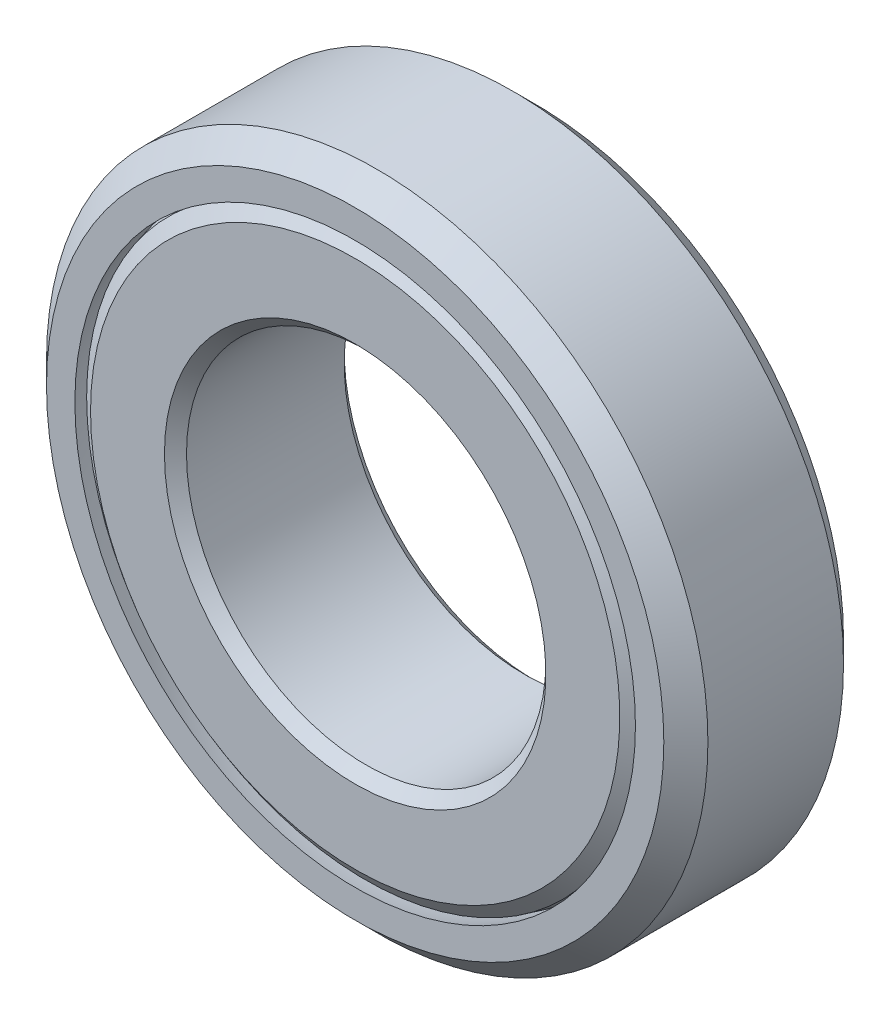
from build123d import *

# Parameters (mm, degrees)
CUT_EXTRUDE1_DEPTH      = 24.200228986
CUT_EXTRUDE1_DEPTH_BACK = 24.200228986
SKETCH7_R               = 18.62743981
SKETCH7_R_2             = 15.62743981
CUT_EXTRUDE2_DEPTH      = 23.473081119
CUT_EXTRUDE2_DEPTH_BACK = 23.473081119
SKETCH9_R               = 15.62743981
SKETCH9_R_2             = 15
CHAMFER1_SIZE           = 1
CHAMFER3_SIZE           = 0.5


with BuildPart() as part:
    # Sketch4 → Revolve4 (revolve)
    with BuildSketch(Plane(origin=(0, 0, 0), x_dir=(1, 0, 0), z_dir=(0, 1, 0))):
        with BuildLine():
            Line((-8.15, -4.075), (-8.15, 0))
            Line((-8.15, 0), (-8.15, 4.075))
            Line((-8.15, 4.075), (-12.502674714, 4.075))
            ThreePointArc((-12.502674714, 4.075), (-13.15, 0), (-12.502674714, -4.075))
            Line((-12.502674714, -4.075), (-8.15, -4.075))
        make_face()
    revolve(axis=Axis((0, 0, 13.15), (0, 0, -1)))

    # Chamfer3
    # the kernel refuses this chamfer: 0.5 mm, written as the material it takes off along each edge
    with BuildSketch(Plane(origin=(0, 0, -4.075), x_dir=(-1, 0, 0), z_dir=(0, -1, 0))) as chamfer3_piece_1:
        Polygon((8.15, -CHAMFER3_SIZE), (8.15 + CHAMFER3_SIZE, 0), (8.15, 0), align=None)
    revolve(axis=Axis((0, 0, -4.075), (0, 0, -1)), mode=Mode.SUBTRACT)
    with BuildSketch(Plane(origin=(0, 0, 4.075), x_dir=(-1, 0, 0), z_dir=(0, -1, 0))) as chamfer3_piece_2:
        Polygon((8.15 + CHAMFER3_SIZE, 0), (8.15, CHAMFER3_SIZE), (8.15, 0), align=None)
    revolve(axis=Axis((0, 0, 4.075), (0, 0, -1)), mode=Mode.SUBTRACT)
    with BuildSketch(Plane(origin=(0, 0, 4.075), x_dir=(-1, 0, 0), z_dir=(0, -1, 0))) as chamfer3_piece_3:
        with BuildLine():
            Line((12.502674714 - CHAMFER3_SIZE, 0), (12.645161709, 0.466345772))
            ThreePointArc((12.645161709, 0.466345772), (12.578409578, 0.240145049), (12.502674714, 0))
            Line((12.502674714, 0), (12.502674714 - CHAMFER3_SIZE, 0))
        make_face()
    revolve(axis=Axis((0, 0, 4.075), (0, 0, -1)), mode=Mode.SUBTRACT)
    with BuildSketch(Plane(origin=(0, 0, -4.075), x_dir=(-1, 0, 0), z_dir=(0, -1, 0))) as chamfer3_piece_4:
        with BuildLine():
            Line((12.502674714 - CHAMFER3_SIZE, 0), (12.645161709, -0.466345772))
            ThreePointArc((12.645161709, -0.466345772), (12.578409578, -0.240145049), (12.502674714, 0))
            Line((12.502674714, 0), (12.502674714 - CHAMFER3_SIZE, 0))
        make_face()
    revolve(axis=Axis((0, 0, -4.075), (0, 0, -1)), mode=Mode.SUBTRACT)


with BuildPart() as body_2:
    # Sketch6 → Revolve5 (revolve)
    with BuildSketch(Plane(origin=(0, 0, 0), x_dir=(1, 0, 0), z_dir=(0, 1, 0))):
        with BuildLine():
            ThreePointArc((-12.712862581, -4.075), (-13.35, 0), (-12.712862581, 4.075))
            Line((-12.712862581, 4.075), (-15.62743981, 4.075))
            ThreePointArc((-15.62743981, 4.075), (-16.15, 0), (-15.62743981, -4.075))
            Line((-15.62743981, -4.075), (-12.712862581, -4.075))
        make_face()
        with BuildLine():
            Line((15.62743981, 4.075), (12.712862581, 4.075))
            ThreePointArc((12.712862581, 4.075), (13.189753892, 2.062254173), (13.35, 0))
            ThreePointArc((13.35, 0), (13.189753892, -2.062254173), (12.712862581, -4.075))
            Line((12.712862581, -4.075), (15.62743981, -4.075))
            ThreePointArc((15.62743981, -4.075), (16.01882725, -2.054184397), (16.15, 0))
            ThreePointArc((16.15, 0), (16.01882725, 2.054184397), (15.62743981, 4.075))
        make_face()
    revolve(axis=Axis((0, 0, 13.15), (0, 0, -1)))

    # Sketch7 → Cut-Extrude1 (cut, two sides: drawn at the far end of the back side and taken through both)
    with BuildSketch(Plane.XY.offset(-CUT_EXTRUDE1_DEPTH_BACK)):
        Circle(SKETCH7_R)
        Circle(SKETCH7_R_2, mode=Mode.SUBTRACT)
    extrude(amount=CUT_EXTRUDE1_DEPTH + CUT_EXTRUDE1_DEPTH_BACK, mode=Mode.SUBTRACT)

    # Sketch9 → Cut-Extrude2 (cut, two sides: drawn at the far end of the back side and taken through both)
    with BuildSketch(Plane.XY.offset(-CUT_EXTRUDE2_DEPTH_BACK)):
        Circle(SKETCH9_R)
        Circle(SKETCH9_R_2, mode=Mode.SUBTRACT)
    extrude(amount=CUT_EXTRUDE2_DEPTH + CUT_EXTRUDE2_DEPTH_BACK, mode=Mode.SUBTRACT)

    # Chamfer1
    chamfer1_edges = [body_2.edges().sort_by_distance(p)[0] for p in [
        (-15, 0, -4.075),
        (-15, 0, 4.075),
    ]]
    chamfer(chamfer1_edges, length=CHAMFER1_SIZE)


solid = Compound([part.part, body_2.part])
